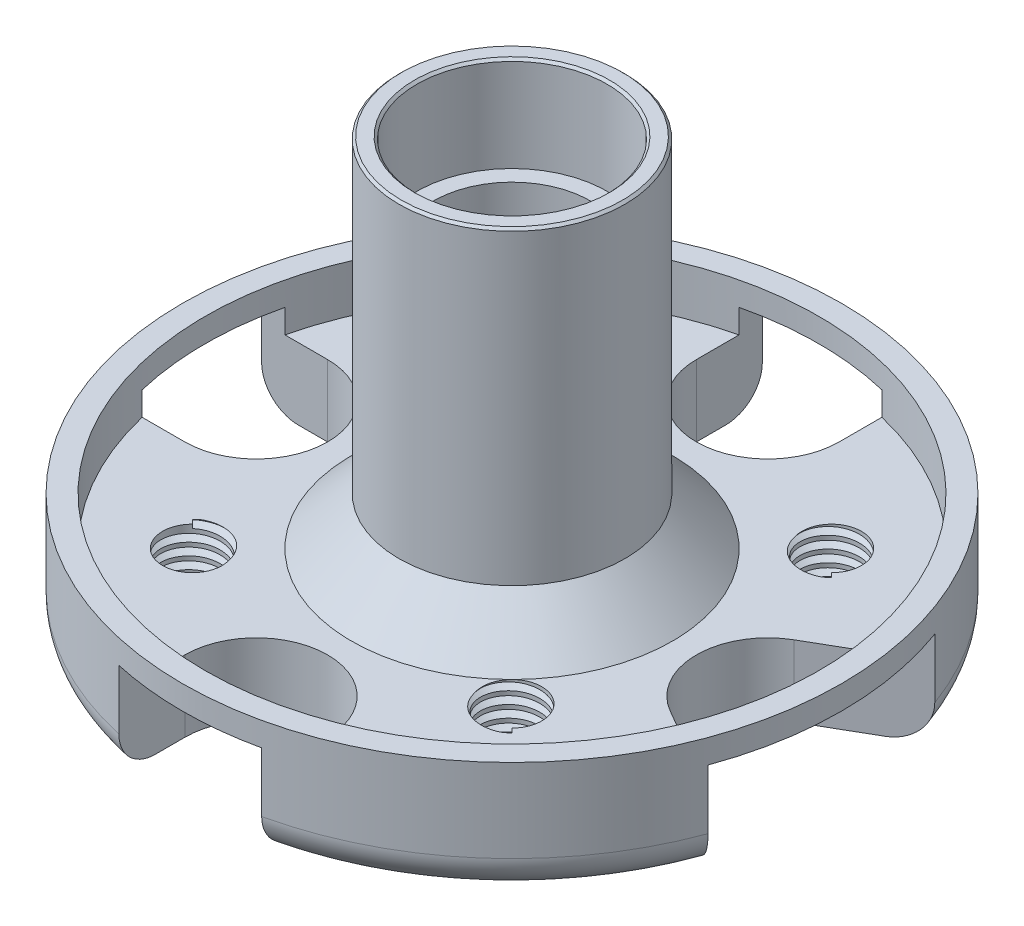
from build123d import *

# Parameters (mm, degrees)
CORTE_EXTRUS_O1_START           = -4
CORTE_EXTRUS_O1_DEPTH           = 4
PADR_OCIRCULAR1_COUNT           = 4
CORTE_EXTRUS_O2_START           = -4
CORTE_EXTRUS_O2_DEPTH           = 4
FURO_ROSCADO_DE_M31_D           = 2.5
FURO_ROSCADO_DE_M31_CSINK_D     = 3.5
FURO_ROSCADO_DE_M31_CSINK_ANGLE = 90
VARREDURA_DE_CORTE8_PITCH       = 0.49999999999999906
PADR_OCIRCULAR2_COUNT           = 2
VARREDURA_DE_CORTE14_PITCH      = 0.49999999999999906
PADR_OCIRCULAR3_COUNT           = 2


with BuildPart() as part:
    # Esboço1 → Revolução1 (revolve)
    with BuildSketch(Plane.XY, mode=Mode.PRIVATE) as revolu_o1_sk:
        with BuildLine():
            Line((4.1000000000000005, 0), (12.34999999999999, 0))
            ThreePointArc((12.34999999999999, 0), (13.410660171779822, 0.4393398282201786), (13.850000000000001, 1.5000000000000107))
            Line((13.850000000000001, 1.5000000000000107), (13.850000000000001, 5))
            Line((13.850000000000001, 5), (12.900000000000002, 5))
            Line((12.900000000000002, 5), (12.900000000000002, 3.0000000000000004))
            Line((12.900000000000002, 3.0000000000000004), (6.750000000000008, 2.999999999999999))
            Line((6.750000000000008, 2.999999999999999), (4.750000000000001, 5.000000000000003))
            Line((4.750000000000001, 5.000000000000003), (4.750000000000001, 17.9))
            Line((4.750000000000001, 17.9), (4.650000000000001, 18))
            Line((4.650000000000001, 18), (4.099999999999999, 18))
            Line((4.099999999999999, 18), (3.9999999999999982, 17.9))
            Line((3.9999999999999982, 17.9), (3.999999999999999, 14.000000000000002))
            Line((3.999999999999999, 14.000000000000002), (3.3, 14.000000000000002))
            Line((3.3, 14.000000000000002), (3.300000000000001, 4))
            Line((3.300000000000001, 4), (4, 4))
            Line((4, 4), (4.000000000000001, 0.1))
            Line((4.000000000000001, 0.1), (4.1000000000000005, 0))
        make_face()
    revolve(revolu_o1_sk.sketch.rotate(Axis((0, 10.806116087134258, 0), (0, -1, 0)), 90), axis=Axis((0, 10.806116087134258, 0), (0, -1, 0)))

    # Esboço2 → Corte-extrusão1 (cut)
    with BuildSketch(Plane.XZ.offset(CORTE_EXTRUS_O1_START)):
        with BuildLine():
            Line((3, 10.75), (3, 13.52118707806382))
            ThreePointArc((3, 13.52118707806382), (8.5e-16, 13.85), (-3, 13.52118707806382))
            Line((-3, 13.52118707806382), (-3, 10.75))
            ThreePointArc((-3, 10.75), (-5.5e-16, 7.75), (3, 10.75))
        make_face()
    corte_extrus_o1 = extrude(amount=CORTE_EXTRUS_O1_DEPTH, mode=Mode.SUBTRACT)

    # PadrãoCircular1: Corte-extrusão1 ×4 about axis
    padr_ocircular1_axis = Axis((-7.51e-15, 0, 0), (0, 1, 0))
    for i in range(1, PADR_OCIRCULAR1_COUNT):
        add(corte_extrus_o1.rotate(padr_ocircular1_axis, i * 360 / PADR_OCIRCULAR1_COUNT), mode=Mode.SUBTRACT)

    # Esboço3 → Corte-extrusão2 (cut)
    with BuildSketch(Plane.XZ.offset(CORTE_EXTRUS_O2_START)):
        with BuildLine():
            Line((9.250000000000005, 2.5980762113534315), (18.71947507739791, 8.065280196373537))
            Line((18.71947507739791, 8.065280196373537), (18.71947507739791, -8.065280196373537))
            Line((18.71947507739791, -8.065280196373537), (9.250000000000005, -2.5980762113534315))
            ThreePointArc((9.250000000000005, -2.5980762113534315), (7.75, 5.568e-14), (9.250000000000005, 2.5980762113534315))
        make_face()
    extrude(amount=CORTE_EXTRUS_O2_DEPTH, mode=Mode.SUBTRACT)

    # Furo roscado de M31 (through all)
    with Locations(Plane(origin=(5.656854249, 0, 5.656854249), x_dir=(0, 0, -1), z_dir=(0, -1, 0))):
        with Locations((0, 0), (12.37436867, 1.060660172), (11.313708498, -11.313708498), (-1.060660172, -12.37436867)):
            CounterSinkHole(FURO_ROSCADO_DE_M31_D / 2, FURO_ROSCADO_DE_M31_CSINK_D / 2, counter_sink_angle=FURO_ROSCADO_DE_M31_CSINK_ANGLE)

    # Varredura de corte8: arcs per turn and ends read off the stored shape
    # Varredura de corte8: the profile of Esboço8 screwed along a right-hand helix through 7 turns, 6 arcs to a turn; built about Z, then put on its axis
    varredura_de_corte8_z = Axis((0, 0, 0), (0, 0, 1))
    varredura_de_corte8_corners = [(1.5, 0, 0.015499993), (1.5, 0, -0.015500007), (1.040140511, 0, -0.281000007), (1.040140511, 0, -0.250000007), (0.940140511, 0, -0.250000007), (0.940140511, 0, 0.249999993), (1.040140511, 0, 0.249999993), (1.040140511, 0, 0.280999993)]
    with BuildLine(mode=Mode.PRIVATE) as varredura_de_corte8_profile:
        Line(varredura_de_corte8_corners[0], varredura_de_corte8_corners[1])
        Line(varredura_de_corte8_corners[1], varredura_de_corte8_corners[2])
        Line(varredura_de_corte8_corners[2], varredura_de_corte8_corners[3])
        Line(varredura_de_corte8_corners[3], varredura_de_corte8_corners[4])
        Line(varredura_de_corte8_corners[4], varredura_de_corte8_corners[5])
        Line(varredura_de_corte8_corners[5], varredura_de_corte8_corners[6])
        Line(varredura_de_corte8_corners[6], varredura_de_corte8_corners[7])
        Line(varredura_de_corte8_corners[7], varredura_de_corte8_corners[0])
    varredura_de_corte8_cap = Face(varredura_de_corte8_profile.wire())
    varredura_de_corte8_turn_angles = [0, 30, 60, 90, 120, 150, 180, 210, 240, 270, 300, 330, 360]
    varredura_de_corte8_turn_weights = [1, 0.8660254037844387, 1, 0.8660254037844387, 1, 0.8660254037844387, 1, 0.8660254037844387, 1, 0.8660254037844387, 1, 0.8660254037844387, 1]
    varredura_de_corte8_turn_rails = [Edge.make_bspline([Vector(p[0], p[1], 0).rotate(varredura_de_corte8_z, varredura_de_corte8_turn_angles[k]) / varredura_de_corte8_turn_weights[k] + Vector(0, 0, p[2] + VARREDURA_DE_CORTE8_PITCH * varredura_de_corte8_turn_angles[k] / 360) for k in range(13)], [0, 0, 0, 1, 1, 2, 2, 3, 3, 4, 4, 5, 5, 6, 6, 6], 2, varredura_de_corte8_turn_weights) for p in varredura_de_corte8_corners]
    varredura_de_corte8_turn_sides = [Face.make_surface_from_curves(varredura_de_corte8_turn_rails[p[0]], varredura_de_corte8_turn_rails[p[1]]) for p in [(0, 1), (1, 2), (2, 3), (3, 4), (4, 5), (5, 6), (6, 7), (7, 0)]]
    varredura_de_corte8 = Plane(origin=(6.71751442127222, 3, -6.7175144212721865), x_dir=(0.707106781186549, 0, 0.7071067811865461), z_dir=(0, -1, 0)) * Solid(Shell([*[p.moved(Location((0, 0, VARREDURA_DE_CORTE8_PITCH * i))) for i in range(7) for p in varredura_de_corte8_turn_sides], varredura_de_corte8_cap, varredura_de_corte8_cap.rotate(varredura_de_corte8_z, 2520).moved(Location((0, 0, VARREDURA_DE_CORTE8_PITCH * 2520 / 360)))]))
    add(varredura_de_corte8, mode=Mode.SUBTRACT)

    # PadrãoCircular2: Varredura de corte8 ×2 about axis
    padr_ocircular2_axis = Axis((0, 10.806116087134258, 0), (0, 1, 0))
    for i in range(1, PADR_OCIRCULAR2_COUNT):
        add(varredura_de_corte8.rotate(padr_ocircular2_axis, i * 360 / PADR_OCIRCULAR2_COUNT), mode=Mode.SUBTRACT)

    # Varredura de corte14: arcs per turn and ends read off the stored shape
    # Varredura de corte14: the profile of Esboço11 screwed along a right-hand helix through 7 turns, 6 arcs to a turn; built about Z, then put on its axis
    varredura_de_corte14_z = Axis((0, 0, 0), (0, 0, 1))
    varredura_de_corte14_corners = [(1.147527661, 0, 0.25), (1.047527661, 0, 0.25), (1.047527661, 0, -0.25), (1.147527661, 0, -0.25), (1.147527661, 0, -0.219), (1.5, 0, -0.0155), (1.5, 0, 0.0155), (1.147527661, 0, 0.219)]
    with BuildLine(mode=Mode.PRIVATE) as varredura_de_corte14_profile:
        Line(varredura_de_corte14_corners[0], varredura_de_corte14_corners[1])
        Line(varredura_de_corte14_corners[1], varredura_de_corte14_corners[2])
        Line(varredura_de_corte14_corners[2], varredura_de_corte14_corners[3])
        Line(varredura_de_corte14_corners[3], varredura_de_corte14_corners[4])
        Line(varredura_de_corte14_corners[4], varredura_de_corte14_corners[5])
        Line(varredura_de_corte14_corners[5], varredura_de_corte14_corners[6])
        Line(varredura_de_corte14_corners[6], varredura_de_corte14_corners[7])
        Line(varredura_de_corte14_corners[7], varredura_de_corte14_corners[0])
    varredura_de_corte14_cap = Face(varredura_de_corte14_profile.wire())
    varredura_de_corte14_turn_angles = [0, 30, 60, 90, 120, 150, 180, 210, 240, 270, 300, 330, 360]
    varredura_de_corte14_turn_weights = [1, 0.8660254037844387, 1, 0.8660254037844387, 1, 0.8660254037844387, 1, 0.8660254037844387, 1, 0.8660254037844387, 1, 0.8660254037844387, 1]
    varredura_de_corte14_turn_rails = [Edge.make_bspline([Vector(p[0], p[1], 0).rotate(varredura_de_corte14_z, varredura_de_corte14_turn_angles[k]) / varredura_de_corte14_turn_weights[k] + Vector(0, 0, p[2] + VARREDURA_DE_CORTE14_PITCH * varredura_de_corte14_turn_angles[k] / 360) for k in range(13)], [0, 0, 0, 1, 1, 2, 2, 3, 3, 4, 4, 5, 5, 6, 6, 6], 2, varredura_de_corte14_turn_weights) for p in varredura_de_corte14_corners]
    varredura_de_corte14_turn_sides = [Face.make_surface_from_curves(varredura_de_corte14_turn_rails[p[0]], varredura_de_corte14_turn_rails[p[1]]) for p in [(0, 1), (1, 2), (2, 3), (3, 4), (4, 5), (5, 6), (6, 7), (7, 0)]]
    varredura_de_corte14 = Plane(origin=(5.656854249492366, 3, 5.6568542494923895), x_dir=(0.7071067811865488, 0, 0.7071067811865465), z_dir=(0, -1, 0)) * Solid(Shell([*[p.moved(Location((0, 0, VARREDURA_DE_CORTE14_PITCH * i))) for i in range(7) for p in varredura_de_corte14_turn_sides], varredura_de_corte14_cap, varredura_de_corte14_cap.rotate(varredura_de_corte14_z, 2520).moved(Location((0, 0, VARREDURA_DE_CORTE14_PITCH * 2520 / 360)))]))
    add(varredura_de_corte14, mode=Mode.SUBTRACT)

    # PadrãoCircular3: Varredura de corte14 ×2 about axis
    padr_ocircular3_axis = Axis((0, 10.806116087134258, 0), (0, 1, 0))
    for i in range(1, PADR_OCIRCULAR3_COUNT):
        add(varredura_de_corte14.rotate(padr_ocircular3_axis, i * 360 / PADR_OCIRCULAR3_COUNT), mode=Mode.SUBTRACT)


solid = part.part
